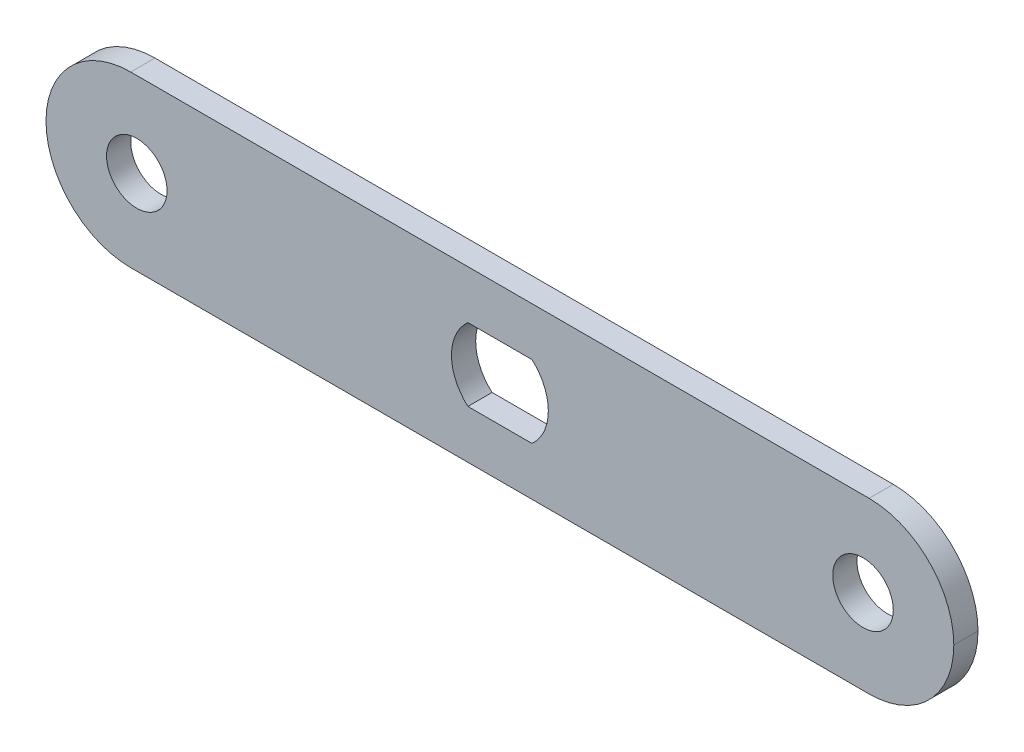
from build123d import *

# Parameters (mm, degrees)
EXTRUDE_1_DEPTH     = 2
SKETCH_2_W          = 75
SKETCH_2_H          = 14
SKETCH_2_R          = 2.5
EXTRUDE_2_DEPTH     = 2
CUT_EXTRUDE_2_DEPTH = 39.20013089
FILLET_1_R          = 7


with BuildPart() as part:
    # 草图1 → 凸台-拉伸1 (new body)
    with BuildSketch(Plane.XY):
        with BuildLine():
            Line((-2.645751311, 3), (2.645751311, 3))
            ThreePointArc((2.645751311, 3), (4, 0), (2.645751311, -3))
            Line((2.645751311, -3), (-2.645751311, -3))
            ThreePointArc((-2.645751311, -3), (-4, 0), (-2.645751311, 3))
        make_face()
    extrude(amount=EXTRUDE_1_DEPTH)

    # 草图2 → 凸台-拉伸2 (add)
    with BuildSketch(Plane.XY.offset(2)):
        Rectangle(SKETCH_2_W, SKETCH_2_H)
        with Locations((-30, 0)):
            Circle(SKETCH_2_R, mode=Mode.SUBTRACT)
        with Locations((30, 0)):
            Circle(SKETCH_2_R, mode=Mode.SUBTRACT)
    extrude(amount=-EXTRUDE_2_DEPTH)

    # 草图3 → 切除-拉伸2 (cut, through all)
    with BuildSketch(Plane.XY):
        with BuildLine():
            Line((-2.645751311, 3), (2.645751311, 3))
            ThreePointArc((2.645751311, 3), (4, 0), (2.645751311, -3))
            Line((2.645751311, -3), (-2.645751311, -3))
            ThreePointArc((-2.645751311, -3), (-4, 0), (-2.645751311, 3))
        make_face()
    extrude(amount=CUT_EXTRUDE_2_DEPTH, mode=Mode.SUBTRACT)

    # 圆角1
    fillet_1_edges = [part.edges().sort_by_distance(p)[0] for p in [
        (37.5, -7, 1),
        (37.5, 7, 1),
        (-37.5, -7, 1),
        (-37.5, 7, 1),
    ]]
    fillet(fillet_1_edges, radius=FILLET_1_R - 0.0001)  # a hair under: the kernel refuses the full size


solid = part.part
